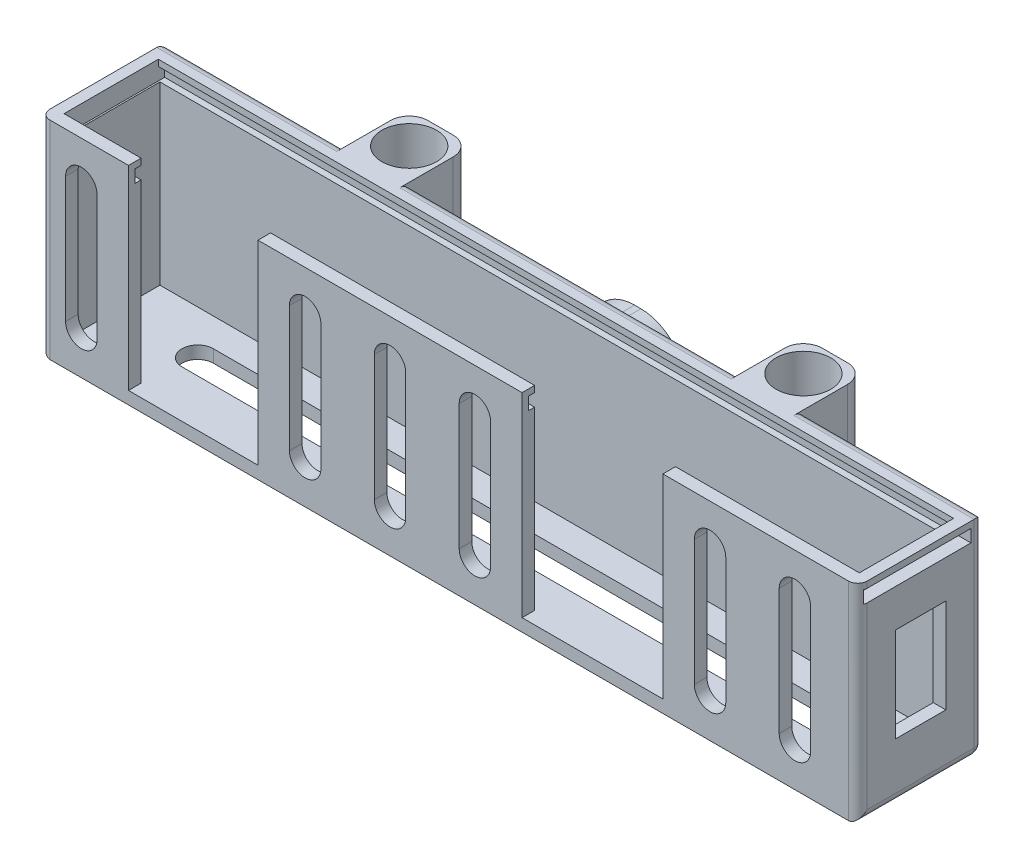
from build123d import *

# Parameters (mm, degrees)
ESBO_O1_W                = 130
ESBO_O1_H                = 33
RESSALTO_EXTRUS_O1_DEPTH = 3
ESBO_O2_W                = 130
ESBO_O2_H                = 33
ESBO_O2_W_2              = 126
ESBO_O2_H_2              = 29
EXTRUS_O_FINA1_DEPTH     = 17
ESBO_O3_W                = 126.5
ESBO_O3_H                = 15
CORTE_EXTRUS_O1_DEPTH    = 2
ESBO_O4_W                = 8
ESBO_O4_H                = 15
CORTE_EXTRUS_O2_DEPTH    = 2
ESBO_O7_W                = 42
ESBO_O7_H                = 2
ESBO_O7_W_2              = 12
ESBO_O7_W_3              = 29
RESSALTO_EXTRUS_O2_DEPTH = 29
ESBO_O8_W                = 20.6
ESBO_O8_H                = 2
ESBO_O8_W_2              = 22.4
CORTE_EXTRUS_O4_DEPTH    = 2
CORTE_EXTRUS_O3_REACH    = 134.56
ESBO_O5_W                = 17
ESBO_O5_H                = 2
CORTE_EXTRUS_O5_DEPTH    = 2
CORTE_EXTRUS_O6_DEPTH    = 2
ESBO_O11_W               = 10
ESBO_O11_H               = 33
RESSALTO_EXTRUS_O3_DEPTH = 10
ESBO_O12_R               = 4.35
CORTE_EXTRUS_O7_DEPTH    = 76.591004756
ESBO_O13_W               = 15
ESBO_O13_H               = 15
RESSALTO_EXTRUS_O4_DEPTH = 10
FILETE1_R                = 7
FILETE2_R                = 3
FILETE3_R                = 1.5


with BuildPart() as part:
    # Esboço1 → Ressalto-extrusão1 (new body)
    with BuildSketch(Plane.XY):
        Rectangle(ESBO_O1_W, ESBO_O1_H)
    extrude(amount=RESSALTO_EXTRUS_O1_DEPTH)

    # Esboço2 → Extrusão-Fina1 (add)
    with BuildSketch(Plane.XY.offset(3)):
        Rectangle(ESBO_O2_W, ESBO_O2_H)
        Rectangle(ESBO_O2_W_2, ESBO_O2_H_2, mode=Mode.SUBTRACT)
    extrude(amount=EXTRUS_O_FINA1_DEPTH)

    # Esboço3 → Corte-extrusão1 (cut)
    with BuildSketch(Plane(origin=(0, 16.5, 0), x_dir=(1, 0, 0), z_dir=(0, 1, 0))):
        with Locations((0, -10.5)):
            Rectangle(ESBO_O3_W, ESBO_O3_H)
    extrude(amount=-CORTE_EXTRUS_O1_DEPTH, mode=Mode.SUBTRACT)

    # Esboço4 → Corte-extrusão2 (cut)
    with BuildSketch(Plane(origin=(65, 0, 0), x_dir=(0, 0, -1), z_dir=(1, 0, 0))):
        with Locations((-10, 0)):
            Rectangle(ESBO_O4_W, ESBO_O4_H)
    extrude(amount=-CORTE_EXTRUS_O2_DEPTH, mode=Mode.SUBTRACT)

    # Esboço7 → Ressalto-extrusão2 (add)
    with BuildSketch(Plane(origin=(0, -14.5, 0), x_dir=(1, 0, 0), z_dir=(0, 1, 0))):
        with Locations((-9.4, -19)):
            Rectangle(ESBO_O7_W, ESBO_O7_H)
        with Locations((-57, -19)):
            Rectangle(ESBO_O7_W_2, ESBO_O7_H)
        with Locations((48.5, -19)):
            Rectangle(ESBO_O7_W_3, ESBO_O7_H)
    extrude(amount=RESSALTO_EXTRUS_O2_DEPTH)

    # Esboço8 → Corte-extrusão4 (cut)
    with BuildSketch(Plane(origin=(0, 16.5, 0), x_dir=(1, 0, 0), z_dir=(0, 1, 0))):
        with Locations((-40.7, -19)):
            Rectangle(ESBO_O8_W, ESBO_O8_H)
        with Locations((22.8, -19)):
            Rectangle(ESBO_O8_W_2, ESBO_O8_H)
    extrude(amount=-CORTE_EXTRUS_O4_DEPTH, mode=Mode.SUBTRACT)

    # Corte-extrusão3: up to this face of the body (flat: up to its plane)
    corte_extrus_o3_end = Plane(part.part.faces().sort_by_distance((-63.25, 15.5, 10.5))[0])
    # Esboço5 → Corte-extrusão3 (cut, up to the picked face)
    with BuildSketch(Plane(origin=(65, 0, 0), x_dir=(0, 0, -1), z_dir=(1, 0, 0)), mode=Mode.PRIVATE) as corte_extrus_o3_sk1:
        with Locations((-10.5, 14.5)):
            Rectangle(ESBO_O5_W, ESBO_O5_H)
    corte_extrus_o3_tool1 = split(extrude(corte_extrus_o3_sk1.sketch, amount=-CORTE_EXTRUS_O3_REACH, mode=Mode.PRIVATE), bisect_by=corte_extrus_o3_end, keep=Keep.BOTH, mode=Mode.PRIVATE)
    add(corte_extrus_o3_tool1.solids().sort_by(Axis((65, 14.5, 10.5), (-1, 0, 0)))[0], mode=Mode.SUBTRACT)

    # Esboço9 → Corte-extrusão5 (cut)
    with BuildSketch(Plane.XY.offset(20)):
        with BuildLine():
            Line((-61, -10), (-61, 10))
            ThreePointArc((-61, 10), (-58.5, 12.5), (-56, 10))
            Line((-56, 10), (-56, -10))
            ThreePointArc((-56, -10), (-58.5, -12.5), (-61, -10))
        make_face()
        with BuildLine():
            Line((-25.4, -10), (-25.4, 10))
            ThreePointArc((-25.4, 10), (-22.9, 12.5), (-20.4, 10))
            Line((-20.4, 10), (-20.4, -10))
            ThreePointArc((-20.4, -10), (-22.9, -12.5), (-25.4, -10))
        make_face()
        with BuildLine():
            Line((-11.9, -10), (-11.9, 10))
            ThreePointArc((-11.9, 10), (-9.4, 12.5), (-6.9, 10))
            Line((-6.9, 10), (-6.9, -10))
            ThreePointArc((-6.9, -10), (-9.4, -12.5), (-11.9, -10))
        make_face()
        with BuildLine():
            Line((1.6, -10), (1.6, 10))
            ThreePointArc((1.6, 10), (4.1, 12.5), (6.6, 10))
            Line((6.6, 10), (6.6, -10))
            ThreePointArc((6.6, -10), (4.1, -12.5), (1.6, -10))
        make_face()
        with BuildLine():
            Line((39, -10), (39, 10))
            ThreePointArc((39, 10), (41.5, 12.5), (44, 10))
            Line((44, 10), (44, -10))
            ThreePointArc((44, -10), (41.5, -12.5), (39, -10))
        make_face()
        with BuildLine():
            Line((52.5, -10), (52.5, 10))
            ThreePointArc((52.5, 10), (55, 12.5), (57.5, 10))
            Line((57.5, 10), (57.5, -10))
            ThreePointArc((57.5, -10), (55, -12.5), (52.5, -10))
        make_face()
    extrude(amount=-CORTE_EXTRUS_O5_DEPTH, mode=Mode.SUBTRACT)

    # Esboço10 → Corte-extrusão6 (cut)
    with BuildSketch(Plane.XZ.offset(16.5)):
        with BuildLine():
            Line((-50, 12.5), (50, 12.5))
            ThreePointArc((50, 12.5), (52.5, 10), (50, 7.5))
            Line((50, 7.5), (-50, 7.5))
            ThreePointArc((-50, 7.5), (-52.5, 10), (-50, 12.5))
        make_face()
    extrude(amount=-CORTE_EXTRUS_O6_DEPTH, mode=Mode.SUBTRACT)

    # Esboço11 → Ressalto-extrusão3 (add)
    with BuildSketch(Plane(origin=(0, 0, 0), x_dir=(-1, 0, 0), z_dir=(0, 0, -1))):
        with Locations((-31.35, 0)):
            Rectangle(ESBO_O11_W, ESBO_O11_H)
        with Locations((31.35, 0)):
            Rectangle(ESBO_O11_W, ESBO_O11_H)
    extrude(amount=RESSALTO_EXTRUS_O3_DEPTH)

    # Esboço12 → Corte-extrusão7 (cut, through all)
    with BuildSketch(Plane.XZ.offset(16.5)):
        with Locations(Location((-31.35, -5, 0), (0, 0, 270))):
            Circle(ESBO_O12_R)
        with Locations(Location((31.35, -5, 0), (0, 0, 90))):
            Circle(ESBO_O12_R)
    extrude(amount=-CORTE_EXTRUS_O7_DEPTH, mode=Mode.SUBTRACT)

    # Esboço13 → Ressalto-extrusão4 (add)
    with BuildSketch(Plane(origin=(0, 0, 0), x_dir=(-1, 0, 0), z_dir=(0, 0, -1))):
        Rectangle(ESBO_O13_W, ESBO_O13_H)
    extrude(amount=RESSALTO_EXTRUS_O4_DEPTH)

    # Filete1
    filete1_edges = [part.edges().sort_by_distance(p)[0] for p in [
        (-7.5, -7.5, -5),
        (-7.5, 7.5, -5),
        (7.5, 7.5, -5),
        (7.5, -7.5, -5),
    ]]
    fillet(filete1_edges, radius=FILETE1_R)

    # Filete2
    filete2_edges = [part.edges().sort_by_distance(p)[0] for p in [
        (26.35, 0, -10),
        (36.35, 0, -10),
        (-36.35, 0, -10),
        (-26.35, 0, -10),
    ]]
    fillet(filete2_edges, radius=FILETE2_R)

    # Filete3
    # the kernel refuses this fillet: 1.5 mm, written as the material it takes off along each edge
    with BuildSketch(Plane(origin=(63.5, -15, 1.5), x_dir=(0, -1, 0), z_dir=(1, 0, 0))) as filete3_piece_1_section:
        Polygon((0, 0), (FILETE3_R, 0), (FILETE3_R, FILETE3_R), (0, FILETE3_R), align=None)
    filete3_piece_1 = extrude(amount=FILETE3_R, mode=Mode.PRIVATE)
    filete3_piece_1 = filete3_piece_1 - Plane(origin=(63.5, -15, 1.5), x_dir=(0, 0.7071067811865475, 0.7071067811865475), z_dir=(1, 0, 0)) * Sphere(FILETE3_R, mode=Mode.PRIVATE)
    add(filete3_piece_1, mode=Mode.SUBTRACT)
    with BuildSketch(Plane(origin=(-63.5, -15, 1.5), x_dir=(0, -1, 0), z_dir=(-1, 0, 0))) as filete3_piece_2_section:
        Polygon((0, 0), (FILETE3_R, 0), (FILETE3_R, -FILETE3_R), (0, -FILETE3_R), align=None)
    filete3_piece_2 = extrude(amount=FILETE3_R, mode=Mode.PRIVATE)
    filete3_piece_2 = filete3_piece_2 - Plane(origin=(-63.5, -15, 1.5), x_dir=(0, 0.7071067811865475, 0.7071067811865475), z_dir=(-1, 0, 0)) * Sphere(FILETE3_R, mode=Mode.PRIVATE)
    add(filete3_piece_2, mode=Mode.SUBTRACT)
    with BuildSketch(Plane(origin=(68.75, 16.5, 0), x_dir=(0, 0, 1), z_dir=(-1, 0, 0)), Plane(origin=(-36.35, 16.5, 0), x_dir=(0, 0, 1), z_dir=(-1, 0, 0))) as filete3_piece_3:
        with BuildLine():
            CenterArc((FILETE3_R, -FILETE3_R), FILETE3_R, 90, 90)
            Line((0, -FILETE3_R), (0, 0))
            Line((0, 0), (FILETE3_R, 0))
        make_face()
    extrude(amount=32.4, mode=Mode.SUBTRACT)
    with BuildSketch(Plane(origin=(26.35, 16.5, 0), x_dir=(0, 0, 1), z_dir=(-1, 0, 0))) as filete3_piece_4:
        with BuildLine():
            CenterArc((FILETE3_R, -FILETE3_R), FILETE3_R, 90, 90)
            Line((0, -FILETE3_R), (0, 0))
            Line((0, 0), (FILETE3_R, 0))
        make_face()
    extrude(amount=52.7, mode=Mode.SUBTRACT)
    with BuildSketch(Plane(origin=(65, -15, 0), x_dir=(-1, 0, 0), z_dir=(0, 1, 0)), Plane(origin=(-65, 20.25, 0), x_dir=(1, 0, 0), z_dir=(0, -1, 0))) as filete3_piece_5:
        with BuildLine():
            CenterArc((FILETE3_R, FILETE3_R), FILETE3_R, 180, 90)
            Line((0, FILETE3_R), (0, 0))
            Line((0, 0), (FILETE3_R, 0))
        make_face()
    extrude(amount=35.25, mode=Mode.SUBTRACT)
    with BuildSketch(Plane(origin=(65, -16.5, 1.5), x_dir=(-1, 0, 0), z_dir=(0, 0, 1)), Plane(origin=(-65, -16.5, 23.75), x_dir=(1, 0, 0), z_dir=(0, 0, -1))) as filete3_piece_6:
        with BuildLine():
            CenterArc((FILETE3_R, -FILETE3_R), FILETE3_R, 90, 90)
            Line((0, -FILETE3_R), (0, 0))
            Line((0, 0), (FILETE3_R, 0))
        make_face()
    extrude(amount=22.25, mode=Mode.SUBTRACT)
    with BuildSketch(Plane(origin=(65, -20.25, 20), x_dir=(0, 0, -1), z_dir=(0, 1, 0))) as filete3_piece_7:
        with BuildLine():
            CenterArc((FILETE3_R, FILETE3_R), FILETE3_R, 180, 90)
            Line((0, FILETE3_R), (0, 0))
            Line((0, 0), (FILETE3_R, 0))
        make_face()
    extrude(amount=40.5, mode=Mode.SUBTRACT)
    with BuildSketch(Plane(origin=(-65, 20.25, 20), x_dir=(1, 0, 0), z_dir=(0, -1, 0))) as filete3_piece_8:
        with BuildLine():
            CenterArc((FILETE3_R, -FILETE3_R), FILETE3_R, 90, 90)
            Line((0, -FILETE3_R), (0, 0))
            Line((0, 0), (FILETE3_R, 0))
        make_face()
    extrude(amount=40.5, mode=Mode.SUBTRACT)
    with BuildSketch(Plane(origin=(36.35, -16.5, 0), x_dir=(0, 0, 1), z_dir=(1, 0, 0)), Plane(origin=(-63.5, -16.5, 0), x_dir=(0, 0, 1), z_dir=(1, 0, 0))) as filete3_piece_9:
        with BuildLine():
            CenterArc((FILETE3_R, -FILETE3_R), FILETE3_R, 90, 90)
            Line((0, -FILETE3_R), (0, 0))
            Line((0, 0), (FILETE3_R, 0))
        make_face()
    extrude(amount=27.15, mode=Mode.SUBTRACT)
    with BuildSketch(Plane(origin=(-26.35, -16.5, 0), x_dir=(0, 1, 0), z_dir=(1, 0, 0))) as filete3_piece_10:
        with BuildLine():
            CenterArc((FILETE3_R, FILETE3_R), FILETE3_R, 180, 90)
            Line((0, FILETE3_R), (0, 0))
            Line((0, 0), (FILETE3_R, 0))
        make_face()
    extrude(amount=52.7, mode=Mode.SUBTRACT)


solid = part.part
